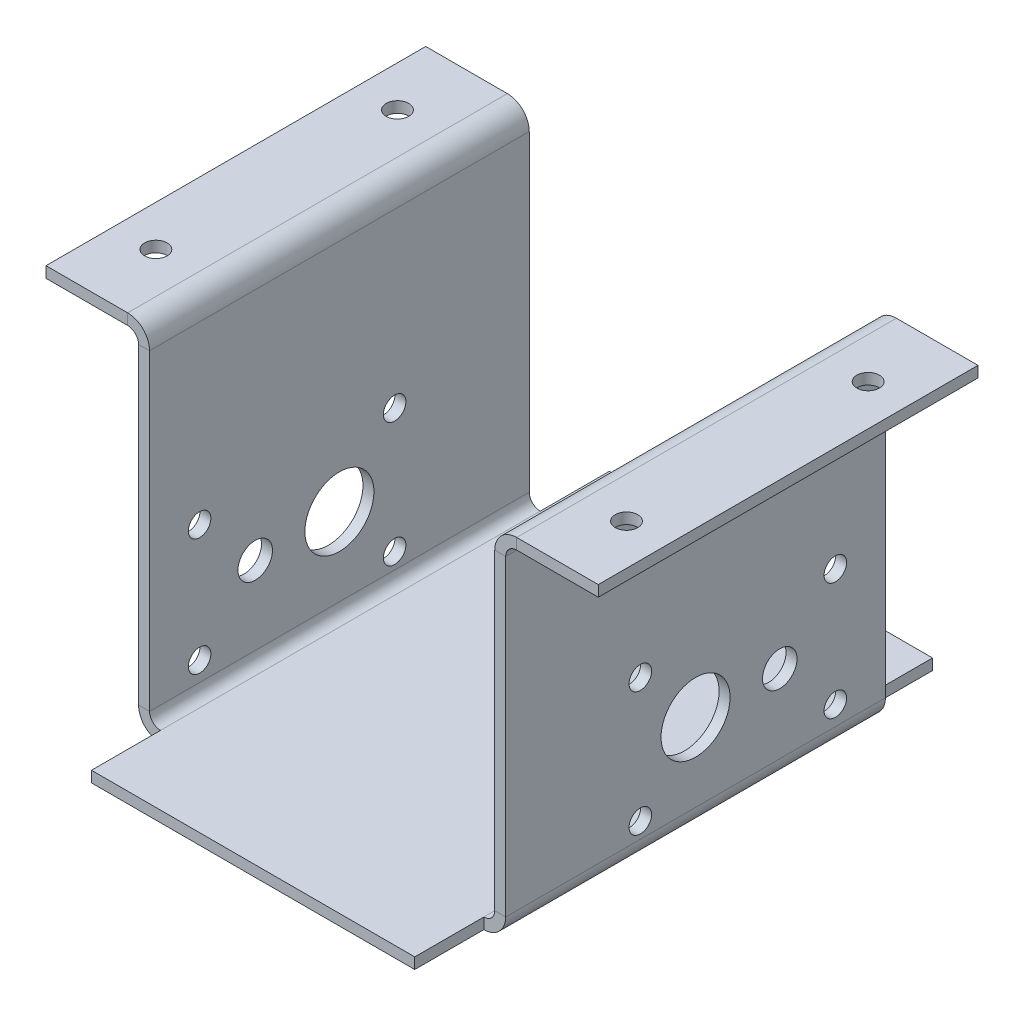
from build123d import *

# Parameters (mm, degrees)
SKETCH1_W                    = 50
SKETCH1_H                    = 75
BASE_FLANGE3_DEPTH           = 1.5875
EDGE_FLANGE1_STRIP_W         = 9.525
EDGE_FLANGE1_STRIP_H         = 1.5875
EDGE_FLANGE1_STRIP_CUT_DEPTH = 75
EDGE_FLANGE1_DEPTH           = 75
EDGE_FLANGE2_STRIP_W         = 9.525
EDGE_FLANGE2_STRIP_H         = 1.5875
EDGE_FLANGE2_STRIP_CUT_DEPTH = 75
EDGE_FLANGE2_DEPTH           = 75
UNFOLD1_START                = -37.5
UNFOLD1_DEPTH                = 75
UNFOLD1_2_DEPTH              = 75
SKETCH36_W                   = 51.908582115
SKETCH36_H                   = 10
EXTRUDE1_DEPTH               = 85.15483092
FOLD1_START                  = -27.5
FOLD1_DEPTH                  = 55
FOLD1_2_DEPTH                = 55
EDGE_FLANGE4_STRIP_W         = 9.525
EDGE_FLANGE4_STRIP_H         = 1.5875
EDGE_FLANGE4_STRIP_CUT_DEPTH = 55
EDGE_FLANGE4_DEPTH           = 55
EDGE_FLANGE5_STRIP_W         = 9.525
EDGE_FLANGE5_STRIP_H         = 1.5875
EDGE_FLANGE5_STRIP_CUT_DEPTH = 55
EDGE_FLANGE5_DEPTH           = 55
F_4_CLEARANCE_HOLE1_D        = 3.2639
SKETCH31_R                   = 5
OUTPUT_SHAFT_CLEARANCE_DEPTH = 93.203119863
SKETCH49_R                   = 2.5
NIPPLE_CLEARANCE_1_DEPTH     = 1.5875
SKETCH50_R                   = 2.5
CUT_EXTRUDE2_DEPTH           = 1.5875
UNFOLD2_START                = -40
UNFOLD2_OUTLINE_W            = 50
UNFOLD2_OUTLINE_H            = 55
UNFOLD2_OUTLINE_R            = 5
UNFOLD2_DEPTH                = 80
UNFOLD2_START_2              = -72.146082115
UNFOLD2_2_OUTLINE_W          = 1.5875
UNFOLD2_2_OUTLINE_H          = 55
UNFOLD2_2_DEPTH              = 28.9344999
UNFOLD2_START_3              = 43.211582215
UNFOLD2_3_OUTLINE_W          = 1.5875
UNFOLD2_3_OUTLINE_H          = 55
UNFOLD2_3_DEPTH              = 28.9344999
UNFOLD2_START_4              = -33.211582015
UNFOLD2_4_OUTLINE_W          = 1.5875
UNFOLD2_4_OUTLINE_H          = 55
UNFOLD2_4_DEPTH              = 66.42316403
UNFOLD2_START_5              = -75.321082115
UNFOLD2_5_OUTLINE_W          = 15
UNFOLD2_5_OUTLINE_H          = 55
UNFOLD2_5_OUTLINE_R          = 1.63195
UNFOLD2_5_DEPTH              = 3.175
UNFOLD2_START_6              = 72.146082115
UNFOLD2_6_OUTLINE_W          = 15
UNFOLD2_6_OUTLINE_H          = 55
UNFOLD2_6_OUTLINE_R          = 1.63195
UNFOLD2_6_DEPTH              = 3.175
UNFOLD2_START_7              = -43.211582215
UNFOLD2_7_OUTLINE_W          = 1.5875
UNFOLD2_7_OUTLINE_H          = 55
UNFOLD2_7_DEPTH              = 86.42316443
UNFOLD2_START_8              = -27.5
UNFOLD2_8_DEPTH              = 55
UNFOLD2_START_9              = -1
UNFOLD2_9_OUTLINE_R          = 5
UNFOLD2_9_OUTLINE_R_2        = 2.5
UNFOLD2_9_DEPTH              = 4
F_4_CLEARANCE_HOLE4_D        = 3.2639
F_4_CLEARANCE_HOLE4_DEPTH    = 3.18
F_4_CLEARANCE_HOLE4_TIP      = 0.980574487
FLAT_PATTERN3_START          = -27.5
FLAT_PATTERN3_DEPTH          = 55
FLAT_PATTERN3_2_DEPTH        = 55


with BuildPart() as part:
    # Base-Flange3: sheet metal written as solids
    # Sketch1 → Base-Flange3 (new body)
    with BuildSketch(Plane(origin=(0, 0, 0), x_dir=(1, 0, 0), z_dir=(0, 1, 0))):
        Rectangle(SKETCH1_W, SKETCH1_H)
    extrude(amount=BASE_FLANGE3_DEPTH)

    # Edge-Flange1: sheet metal written as solids
    # Edge-Flange1 strip (on a plane across the edge) → Edge-Flange1 strip cut (cut)
    with BuildSketch(Plane(origin=(-25, 1.5875, -37.5), x_dir=(1, 0, 0), z_dir=(0, 0, 1))):
        with Locations((-3.175, -0.79375)):
            Rectangle(EDGE_FLANGE1_STRIP_W, EDGE_FLANGE1_STRIP_H)
    extrude(amount=EDGE_FLANGE1_STRIP_CUT_DEPTH, mode=Mode.SUBTRACT)

    # Edge-Flange1 section (on a plane across the edge) → Edge-Flange1 (add)
    with BuildSketch(Plane(origin=(-25, 1.5875, -37.5), x_dir=(1, 0, 0), z_dir=(0, 0, 1))):
        with BuildLine():
            Line((-1.5875, 1.5875), (-1.5875, 50))
            Line((-1.5875, 50), (0, 50))
            Line((0, 50), (0, 1.5875))
            ThreePointArc((0, 1.5875), (0.464967985, 0.464967985), (1.5875, 0))
            Line((1.5875, 0), (1.5875, -1.5875))
            ThreePointArc((1.5875, -1.5875), (-0.65756403, -0.65756403), (-1.5875, 1.5875))
        make_face()
    extrude(amount=EDGE_FLANGE1_DEPTH)

    # Edge-Flange2: sheet metal written as solids
    # Edge-Flange2 strip (on a plane across the edge) → Edge-Flange2 strip cut (cut)
    with BuildSketch(Plane(origin=(25, 1.5875, 37.5), x_dir=(-1, 0, 0), z_dir=(0, 0, -1))):
        with Locations((-3.175, -0.79375)):
            Rectangle(EDGE_FLANGE2_STRIP_W, EDGE_FLANGE2_STRIP_H)
    extrude(amount=EDGE_FLANGE2_STRIP_CUT_DEPTH, mode=Mode.SUBTRACT)

    # Edge-Flange2 section (on a plane across the edge) → Edge-Flange2 (add)
    with BuildSketch(Plane(origin=(25, 1.5875, 37.5), x_dir=(-1, 0, 0), z_dir=(0, 0, -1))):
        with BuildLine():
            Line((-1.5875, 1.5875), (-1.5875, 50))
            Line((-1.5875, 50), (0, 50))
            Line((0, 50), (0, 1.5875))
            ThreePointArc((0, 1.5875), (0.464967985, 0.464967985), (1.5875, 0))
            Line((1.5875, 0), (1.5875, -1.5875))
            ThreePointArc((1.5875, -1.5875), (-0.65756403, -0.65756403), (-1.5875, 1.5875))
        make_face()
    extrude(amount=EDGE_FLANGE2_DEPTH)

    # Unfold1: read off the stored shape, not the designer's step
    # Unfold1 outline → Unfold1 (cut)
    with BuildSketch(Plane.XY.offset(UNFOLD1_START)):
        with BuildLine():
            Line((-26.162130657, 1.5875), (-23.4125, 1.5875))
            ThreePointArc((-23.4125, 1.5875), (-24.535032015, 2.052467985), (-25, 3.175))
            Line((-25, 3.175), (-25, 51.5875))
            Line((-25, 51.5875), (-26.5875, 51.5875))
            Line((-26.5875, 51.5875), (-26.5875, 3.175))
            ThreePointArc((-26.5875, 3.175), (-26.479314498, 2.353249532), (-26.162130657, 1.5875))
        make_face()
        with BuildLine():
            Line((23.4125, 1.5875), (26.162130657, 1.5875))
            ThreePointArc((26.162130657, 1.5875), (26.479314498, 2.353249532), (26.5875, 3.175))
            Line((26.5875, 3.175), (26.5875, 51.5875))
            Line((26.5875, 51.5875), (25, 51.5875))
            Line((25, 51.5875), (25, 3.175))
            ThreePointArc((25, 3.175), (24.535032015, 2.052467985), (23.4125, 1.5875))
        make_face()
    extrude(amount=UNFOLD1_DEPTH, mode=Mode.SUBTRACT)

    # Unfold1 2 outline → Unfold1 2 (add)
    with BuildSketch(Plane.XY.offset(UNFOLD1_START)):
        with BuildLine():
            ThreePointArc((-23.4125, 0), (-25, 0.425369343), (-26.162130657, 1.5875))
            Line((-26.162130657, 1.5875), (-75.321082115, 1.5875))
            Line((-75.321082115, 1.5875), (-75.321082115, 0))
            Line((-75.321082115, 0), (-23.4125, 0))
        make_face()
        with BuildLine():
            Line((75.321082115, 1.5875), (26.162130657, 1.5875))
            ThreePointArc((26.162130657, 1.5875), (25, 0.425369343), (23.4125, 0))
            Line((23.4125, 0), (75.321082115, 0))
            Line((75.321082115, 0), (75.321082115, 1.5875))
        make_face()
    extrude(amount=UNFOLD1_2_DEPTH)

    # Sketch36 → Extrude1 (cut, through all)
    with BuildSketch(Plane(origin=(0, 1.5875, 0), x_dir=(1, 0, 0), z_dir=(0, 1, 0))):
        with Locations((-49.366791058, 32.5)):
            Rectangle(SKETCH36_W, SKETCH36_H)
        with Locations((49.366791058, 32.5)):
            Rectangle(SKETCH36_W, SKETCH36_H)
        with Locations((-49.366791058, -32.5)):
            Rectangle(SKETCH36_W, SKETCH36_H)
        with Locations((49.366791058, -32.5)):
            Rectangle(SKETCH36_W, SKETCH36_H)
    extrude(amount=-EXTRUDE1_DEPTH, mode=Mode.SUBTRACT)

    # Fold1: read off the stored shape, not the designer's step
    # Fold1 outline → Fold1 (cut)
    with BuildSketch(Plane.XY.offset(FOLD1_START)):
        with BuildLine():
            ThreePointArc((-23.4125, 0), (-25, 0.425369343), (-26.162130657, 1.5875))
            Line((-26.162130657, 1.5875), (-75.321082115, 1.5875))
            Line((-75.321082115, 1.5875), (-75.321082115, 0))
            Line((-75.321082115, 0), (-23.4125, 0))
        make_face()
        with BuildLine():
            Line((75.321082115, 1.5875), (26.162130657, 1.5875))
            ThreePointArc((26.162130657, 1.5875), (25, 0.425369343), (23.4125, 0))
            Line((23.4125, 0), (75.321082115, 0))
            Line((75.321082115, 0), (75.321082115, 1.5875))
        make_face()
    extrude(amount=FOLD1_DEPTH, mode=Mode.SUBTRACT)

    # Fold1 2 outline → Fold1 2 (add)
    with BuildSketch(Plane.XY.offset(FOLD1_START)):
        with BuildLine():
            ThreePointArc((-23.4125, 1.5875), (-24.535032015, 2.052467985), (-25, 3.175))
            Line((-25, 3.175), (-25, 51.5875))
            Line((-25, 51.5875), (-26.5875, 51.5875))
            Line((-26.5875, 51.5875), (-26.5875, 3.175))
            ThreePointArc((-26.5875, 3.175), (-26.479314498, 2.353249532), (-26.162130657, 1.5875))
            Line((-26.162130657, 1.5875), (-23.4125, 1.5875))
        make_face()
        with BuildLine():
            Line((26.5875, 51.5875), (25, 51.5875))
            Line((25, 51.5875), (25, 3.175))
            ThreePointArc((25, 3.175), (24.535032015, 2.052467985), (23.4125, 1.5875))
            Line((23.4125, 1.5875), (26.162130657, 1.5875))
            ThreePointArc((26.162130657, 1.5875), (26.479314498, 2.353249532), (26.5875, 3.175))
            Line((26.5875, 3.175), (26.5875, 51.5875))
        make_face()
    extrude(amount=FOLD1_2_DEPTH)

    # Edge-Flange4: sheet metal written as solids
    # Edge-Flange4 strip (on a plane across the edge) → Edge-Flange4 strip cut (cut)
    with BuildSketch(Plane(origin=(-26.5875, 51.5875, 27.5), x_dir=(0, -1, 0), z_dir=(0, 0, -1))):
        with Locations((-1.5875, -0.79375)):
            Rectangle(EDGE_FLANGE4_STRIP_W, EDGE_FLANGE4_STRIP_H)
    extrude(amount=EDGE_FLANGE4_STRIP_CUT_DEPTH, mode=Mode.SUBTRACT)

    # Edge-Flange4 section (on a plane across the edge) → Edge-Flange4 (add)
    with BuildSketch(Plane(origin=(-26.5875, 51.5875, 27.5), x_dir=(0, -1, 0), z_dir=(0, 0, -1))):
        with BuildLine():
            Line((0, 1.5875), (0, 13.4125))
            Line((0, 13.4125), (1.5875, 13.4125))
            Line((1.5875, 13.4125), (1.5875, 1.5875))
            ThreePointArc((1.5875, 1.5875), (2.052467985, 0.464967985), (3.175, 0))
            Line((3.175, 0), (3.175, -1.5875))
            ThreePointArc((3.175, -1.5875), (0.92993597, -0.65756403), (0, 1.5875))
        make_face()
    extrude(amount=EDGE_FLANGE4_DEPTH)

    # Edge-Flange5: sheet metal written as solids
    # Edge-Flange5 strip (on a plane across the edge) → Edge-Flange5 strip cut (cut)
    with BuildSketch(Plane(origin=(26.5875, 51.5875, -27.5), x_dir=(0, -1, 0), z_dir=(0, 0, 1))):
        with Locations((-1.5875, -0.79375)):
            Rectangle(EDGE_FLANGE5_STRIP_W, EDGE_FLANGE5_STRIP_H)
    extrude(amount=EDGE_FLANGE5_STRIP_CUT_DEPTH, mode=Mode.SUBTRACT)

    # Edge-Flange5 section (on a plane across the edge) → Edge-Flange5 (add)
    with BuildSketch(Plane(origin=(26.5875, 51.5875, -27.5), x_dir=(0, -1, 0), z_dir=(0, 0, 1))):
        with BuildLine():
            Line((0, 1.5875), (0, 13.4125))
            Line((0, 13.4125), (1.5875, 13.4125))
            Line((1.5875, 13.4125), (1.5875, 1.5875))
            ThreePointArc((1.5875, 1.5875), (2.052467985, 0.464967985), (3.175, 0))
            Line((3.175, 0), (3.175, -1.5875))
            ThreePointArc((3.175, -1.5875), (0.92993597, -0.65756403), (0, 1.5875))
        make_face()
    extrude(amount=EDGE_FLANGE5_DEPTH)

    # #4 Clearance Hole1 (through all)
    with Locations(Plane(origin=(0, 51.5875, 0), x_dir=(-1, 0, 0), z_dir=(0, 1, 0))):
        with Locations((34.0875, -17.5), (34.0875, 17.5), (-34.0875, -17.5), (-34.0875, 17.5)):
            Hole(F_4_CLEARANCE_HOLE1_D / 2)

    # Sketch31 → Output shaft clearance (cut, through all)
    with BuildSketch(Plane(origin=(26.5875, 0, 0), x_dir=(0, 0, -1), z_dir=(1, 0, 0))):
        with Locations(Location((0, 14.478, 0), (0, 0, 90))):
            Circle(SKETCH31_R)
    extrude(amount=-OUTPUT_SHAFT_CLEARANCE_DEPTH, mode=Mode.SUBTRACT)

    # Sketch49 → Nipple Clearance 1 (cut)
    with BuildSketch(Plane(origin=(26.5875, 0, 0), x_dir=(0, 0, -1), z_dir=(1, 0, 0))):
        with Locations(Location((12.19708, 14.478, 0), (0, 0, 90))):
            Circle(SKETCH49_R)
    extrude(amount=-NIPPLE_CLEARANCE_1_DEPTH, mode=Mode.SUBTRACT)

    # Sketch50 → Cut-Extrude2 (cut)
    with BuildSketch(Plane.ZY.offset(26.5875)):
        with Locations(Location((12.19708, 14.478, 0), (0, 0, 270))):
            Circle(SKETCH50_R)
    extrude(amount=-CUT_EXTRUDE2_DEPTH, mode=Mode.SUBTRACT)

    # Unfold2: read off the stored shape, not the designer's step
    # Unfold2 outline → Unfold2 (cut)
    with BuildSketch(Plane.YZ.offset(UNFOLD2_START)):
        with Locations((26.5875, 0)):
            Rectangle(UNFOLD2_OUTLINE_W, UNFOLD2_OUTLINE_H)
        with Locations((14.478, 0)):
            Circle(UNFOLD2_OUTLINE_R, mode=Mode.SUBTRACT)
    extrude(amount=UNFOLD2_DEPTH, mode=Mode.SUBTRACT)

    # Unfold2 4 outline → Unfold2 4 (add)
    with BuildSketch(Plane.YZ.offset(UNFOLD2_START_4)):
        with Locations((0.79375, 0)):
            Rectangle(UNFOLD2_4_OUTLINE_W, UNFOLD2_4_OUTLINE_H)
    extrude(amount=UNFOLD2_4_DEPTH)



with BuildPart() as body_2:
    # Unfold2 2 outline → Unfold2 2 (new body)
    with BuildSketch(Plane.YZ.offset(UNFOLD2_START_2)):
        with Locations((0.79375, 0)):
            Rectangle(UNFOLD2_2_OUTLINE_W, UNFOLD2_2_OUTLINE_H)
    extrude(amount=UNFOLD2_2_DEPTH)

    # Unfold2 5 outline → Unfold2 5 (add)
    with BuildSketch(Plane.YZ.offset(UNFOLD2_START_5)):
        with Locations((-5.9125, 0)):
            Rectangle(UNFOLD2_5_OUTLINE_W, UNFOLD2_5_OUTLINE_H)
        with Locations((-7.5, 17.5)):
            Circle(UNFOLD2_5_OUTLINE_R, mode=Mode.SUBTRACT)
        with Locations((-7.5, -17.5)):
            Circle(UNFOLD2_5_OUTLINE_R, mode=Mode.SUBTRACT)
    extrude(amount=UNFOLD2_5_DEPTH)


with BuildPart() as body_3:
    # Unfold2 3 outline → Unfold2 3 (new body)
    with BuildSketch(Plane.YZ.offset(UNFOLD2_START_3)):
        with Locations((0.79375, 0)):
            Rectangle(UNFOLD2_3_OUTLINE_W, UNFOLD2_3_OUTLINE_H)
    extrude(amount=UNFOLD2_3_DEPTH)

    # Unfold2 6 outline → Unfold2 6 (add)
    with BuildSketch(Plane.YZ.offset(UNFOLD2_START_6)):
        with Locations((-5.9125, 0)):
            Rectangle(UNFOLD2_6_OUTLINE_W, UNFOLD2_6_OUTLINE_H)
        with Locations((-7.5, 17.5)):
            Circle(UNFOLD2_6_OUTLINE_R, mode=Mode.SUBTRACT)
        with Locations((-7.5, -17.5)):
            Circle(UNFOLD2_6_OUTLINE_R, mode=Mode.SUBTRACT)
    extrude(amount=UNFOLD2_6_DEPTH)


with BuildPart() as part_1:
    add(part.part)

    add(body_2.part)  # Unfold2 7 merges body 2

    add(body_3.part)  # Unfold2 7 merges body 3
    # Unfold2 7 outline → Unfold2 7 (add)
    with BuildSketch(Plane.YZ.offset(UNFOLD2_START_7)):
        with Locations((0.79375, 0)):
            Rectangle(UNFOLD2_7_OUTLINE_W, UNFOLD2_7_OUTLINE_H)
    extrude(amount=UNFOLD2_7_DEPTH)

    # Unfold2 8 outline → Unfold2 8 (cut)
    with BuildSketch(Plane.XY.offset(UNFOLD2_START_8)):
        with BuildLine():
            Line((-73.733582115, -1.5875), (-73.733582115, -13.4125))
            Line((-73.733582115, -13.4125), (-72.146082115, -13.4125))
            Line((-72.146082115, -13.4125), (-72.146082115, 0))
            ThreePointArc((-72.146082115, 0), (-73.26861413, -0.464967985), (-73.733582115, -1.5875))
        make_face()
        with BuildLine():
            Line((-75.321082115, 1.5875), (-75.321082115, -1.5875))
            ThreePointArc((-75.321082115, -1.5875), (-74.391146145, 0.65756403), (-72.146082115, 1.5875))
            Line((-72.146082115, 1.5875), (-75.321082115, 1.5875))
        make_face()
        with BuildLine():
            ThreePointArc((73.733582115, -1.5875), (73.26861413, -0.464967985), (72.146082115, 0))
            Line((72.146082115, 0), (72.146082115, -13.4125))
            Line((72.146082115, -13.4125), (73.733582115, -13.4125))
            Line((73.733582115, -13.4125), (73.733582115, -1.5875))
        make_face()
        with BuildLine():
            Line((75.321082115, 1.5875), (72.146082115, 1.5875))
            ThreePointArc((72.146082115, 1.5875), (74.391146145, 0.65756403), (75.321082115, -1.5875))
            Line((75.321082115, -1.5875), (75.321082115, 1.5875))
        make_face()
    extrude(amount=UNFOLD2_8_DEPTH, mode=Mode.SUBTRACT)

    # Unfold2 9 outline → Unfold2 9 (cut)
    with BuildSketch(Plane(origin=(0, 0, 0), x_dir=(1, 0, 0), z_dir=(0, 1, 0)).offset(UNFOLD2_START_9)):
        with Locations((-38.211582115, 0)):
            Circle(UNFOLD2_9_OUTLINE_R)
        with Locations((-38.211582115, -12.19708)):
            Circle(UNFOLD2_9_OUTLINE_R_2)
        with Locations((38.211582115, 0)):
            Circle(UNFOLD2_9_OUTLINE_R)
        with Locations((38.211582115, 12.19708)):
            Circle(UNFOLD2_9_OUTLINE_R_2)
    extrude(amount=UNFOLD2_9_DEPTH, mode=Mode.SUBTRACT)

    # #4 Clearance Hole4
    with Locations(Plane(origin=(0, 1.5875, 0), x_dir=(-1, 0, 0), z_dir=(0, 1, 0))):
        with Locations((29.212362115, -7.99846), (29.711472115, 20.25142), (46.711692115, 20.25142), (47.210802115, -7.99846), (-29.711472115, -20.25142), (-46.711692115, -20.25142), (-47.210802115, 7.99846), (-29.212362115, 7.99846)):
            Hole(F_4_CLEARANCE_HOLE4_D / 2, depth=F_4_CLEARANCE_HOLE4_DEPTH)
            with Locations((0, 0, -(F_4_CLEARANCE_HOLE4_DEPTH + F_4_CLEARANCE_HOLE4_TIP / 2))):  # 118° drill point
                Cone(0, F_4_CLEARANCE_HOLE4_D / 2, F_4_CLEARANCE_HOLE4_TIP, mode=Mode.SUBTRACT)

    # Flat-Pattern3: read off the stored shape, not the designer's step
    # Flat-Pattern3 outline → Flat-Pattern3 (cut)
    with BuildSketch(Plane.XY.offset(FLAT_PATTERN3_START)):
        with BuildLine():
            ThreePointArc((-23.4125, 0), (-25, 0.425369343), (-26.162130657, 1.5875))
            Line((-26.162130657, 1.5875), (-72.146082115, 1.5875))
            ThreePointArc((-72.146082115, 1.5875), (-74.391146145, 0.65756403), (-75.321082115, -1.5875))
            Line((-75.321082115, -1.5875), (-75.321082115, -13.4125))
            Line((-75.321082115, -13.4125), (-73.733582115, -13.4125))
            Line((-73.733582115, -13.4125), (-73.733582115, -1.5875))
            ThreePointArc((-73.733582115, -1.5875), (-73.26861413, -0.464967985), (-72.146082115, 0))
            Line((-72.146082115, 0), (-23.4125, 0))
        make_face()
        with BuildLine():
            Line((72.146082115, 1.5875), (26.162130657, 1.5875))
            ThreePointArc((26.162130657, 1.5875), (25, 0.425369343), (23.4125, 0))
            Line((23.4125, 0), (72.146082115, 0))
            ThreePointArc((72.146082115, 0), (73.26861413, -0.464967985), (73.733582115, -1.5875))
            Line((73.733582115, -1.5875), (73.733582115, -13.4125))
            Line((73.733582115, -13.4125), (75.321082115, -13.4125))
            Line((75.321082115, -13.4125), (75.321082115, -1.5875))
            ThreePointArc((75.321082115, -1.5875), (74.391146145, 0.65756403), (72.146082115, 1.5875))
        make_face()
    extrude(amount=FLAT_PATTERN3_DEPTH, mode=Mode.SUBTRACT)

    # Flat-Pattern3 2 outline → Flat-Pattern3 2 (add)
    with BuildSketch(Plane.XY.offset(FLAT_PATTERN3_START)):
        with BuildLine():
            ThreePointArc((-23.4125, 1.5875), (-24.535032015, 2.052467985), (-25, 3.175))
            Line((-25, 3.175), (-25, 48.4125))
            ThreePointArc((-25, 48.4125), (-25.92993597, 50.65756403), (-28.175, 51.5875))
            Line((-28.175, 51.5875), (-40, 51.5875))
            Line((-40, 51.5875), (-40, 50))
            Line((-40, 50), (-28.175, 50))
            ThreePointArc((-28.175, 50), (-27.052467985, 49.535032015), (-26.5875, 48.4125))
            Line((-26.5875, 48.4125), (-26.5875, 3.175))
            ThreePointArc((-26.5875, 3.175), (-26.479314498, 2.353249532), (-26.162130657, 1.5875))
            Line((-26.162130657, 1.5875), (-23.4125, 1.5875))
        make_face()
        with BuildLine():
            ThreePointArc((26.5875, 48.4125), (27.052467985, 49.535032015), (28.175, 50))
            Line((28.175, 50), (40, 50))
            Line((40, 50), (40, 51.5875))
            Line((40, 51.5875), (28.175, 51.5875))
            ThreePointArc((28.175, 51.5875), (25.92993597, 50.65756403), (25, 48.4125))
            Line((25, 48.4125), (25, 3.175))
            ThreePointArc((25, 3.175), (24.535032015, 2.052467985), (23.4125, 1.5875))
            Line((23.4125, 1.5875), (26.162130657, 1.5875))
            ThreePointArc((26.162130657, 1.5875), (26.479314498, 2.353249532), (26.5875, 3.175))
            Line((26.5875, 3.175), (26.5875, 48.4125))
        make_face()
    extrude(amount=FLAT_PATTERN3_2_DEPTH)

    # Flat-Pattern3 3: loft between two sections, ruled curve by curve
    flat_pattern3_3_from = [
        Edge.make_three_point_arc((-34.0875, 50, 19.13195), (-32.45555, 50, 17.5), (-34.0875, 50, 15.86805)),
        Edge.make_three_point_arc((-34.0875, 50, 15.86805), (-35.71945, 50, 17.5), (-34.0875, 50, 19.13195)),
    ]
    flat_pattern3_3_to = [
        Edge.make_three_point_arc((-34.0875, 51.5875, 19.13195), (-32.45555, 51.5875, 17.5), (-34.0875, 51.5875, 15.86805)),
        Edge.make_three_point_arc((-34.0875, 51.5875, 15.86805), (-35.71945, 51.5875, 17.5), (-34.0875, 51.5875, 19.13195)),
    ]
    flat_pattern3_3 = Solid(Shell([*[Face.make_surface_from_curves(flat_pattern3_3_from[k], flat_pattern3_3_to[k]) for k in range(2)], Face(Wire(flat_pattern3_3_from)), Face(Wire(flat_pattern3_3_to))]))
    add(flat_pattern3_3, mode=Mode.SUBTRACT)

    # Flat-Pattern3 4: loft between two sections, ruled curve by curve
    flat_pattern3_4_from = [
        Edge.make_three_point_arc((-34.0875, 50, -15.86805), (-32.45555, 50, -17.5), (-34.0875, 50, -19.13195)),
        Edge.make_three_point_arc((-34.0875, 50, -19.13195), (-35.71945, 50, -17.5), (-34.0875, 50, -15.86805)),
    ]
    flat_pattern3_4_to = [
        Edge.make_three_point_arc((-34.0875, 51.5875, -15.86805), (-32.45555, 51.5875, -17.5), (-34.0875, 51.5875, -19.13195)),
        Edge.make_three_point_arc((-34.0875, 51.5875, -19.13195), (-35.71945, 51.5875, -17.5), (-34.0875, 51.5875, -15.86805)),
    ]
    flat_pattern3_4 = Solid(Shell([*[Face.make_surface_from_curves(flat_pattern3_4_from[k], flat_pattern3_4_to[k]) for k in range(2)], Face(Wire(flat_pattern3_4_from)), Face(Wire(flat_pattern3_4_to))]))
    add(flat_pattern3_4, mode=Mode.SUBTRACT)

    # Flat-Pattern3 5: loft between two sections, ruled curve by curve
    flat_pattern3_5_from = [
        Edge.make_three_point_arc((-26.5875, 19.478, 0), (-26.5875, 14.478, 5), (-26.5875, 9.478, 0)),
        Edge.make_three_point_arc((-26.5875, 9.478, 0), (-26.5875, 14.478, -5), (-26.5875, 19.478, 0)),
    ]
    flat_pattern3_5_to = [
        Edge.make_three_point_arc((-25, 19.478, 0), (-25, 14.478, 5), (-25, 9.478, 0)),
        Edge.make_three_point_arc((-25, 9.478, 0), (-25, 14.478, -5), (-25, 19.478, 0)),
    ]
    flat_pattern3_5 = Solid(Shell([*[Face.make_surface_from_curves(flat_pattern3_5_from[k], flat_pattern3_5_to[k]) for k in range(2)], Face(Wire(flat_pattern3_5_from)), Face(Wire(flat_pattern3_5_to))]))
    add(flat_pattern3_5, mode=Mode.SUBTRACT)

    # Flat-Pattern3 6: loft between two sections, ruled curve by curve
    flat_pattern3_6_from = [
        Edge.make_three_point_arc((25, 19.478, 0), (25, 14.478, 5), (25, 9.478, 0)),
        Edge.make_three_point_arc((25, 9.478, 0), (25, 14.478, -5), (25, 19.478, 0)),
    ]
    flat_pattern3_6_to = [
        Edge.make_three_point_arc((26.5875, 19.478, 0), (26.5875, 14.478, 5), (26.5875, 9.478, 0)),
        Edge.make_three_point_arc((26.5875, 9.478, 0), (26.5875, 14.478, -5), (26.5875, 19.478, 0)),
    ]
    flat_pattern3_6 = Solid(Shell([*[Face.make_surface_from_curves(flat_pattern3_6_from[k], flat_pattern3_6_to[k]) for k in range(2)], Face(Wire(flat_pattern3_6_from)), Face(Wire(flat_pattern3_6_to))]))
    add(flat_pattern3_6, mode=Mode.SUBTRACT)

    # Flat-Pattern3 7: loft between two sections, ruled curve by curve
    flat_pattern3_7_from = [
        Edge.make_three_point_arc((-25, 11.978, 12.19708), (-25, 14.478, 14.69708), (-25, 16.978, 12.19708)),
        Edge.make_three_point_arc((-25, 16.978, 12.19708), (-25, 14.478, 9.69708), (-25, 11.978, 12.19708)),
    ]
    flat_pattern3_7_to = [
        Edge.make_three_point_arc((-26.5875, 11.978, 12.19708), (-26.5875, 14.478, 14.69708), (-26.5875, 16.978, 12.19708)),
        Edge.make_three_point_arc((-26.5875, 16.978, 12.19708), (-26.5875, 14.478, 9.69708), (-26.5875, 11.978, 12.19708)),
    ]
    flat_pattern3_7 = Solid(Shell([*[Face.make_surface_from_curves(flat_pattern3_7_from[k], flat_pattern3_7_to[k]) for k in range(2)], Face(Wire(flat_pattern3_7_from)), Face(Wire(flat_pattern3_7_to))]))
    add(flat_pattern3_7, mode=Mode.SUBTRACT)

    # Flat-Pattern3 8: loft between two sections, ruled curve by curve
    flat_pattern3_8_from = [
        Edge.make_three_point_arc((-26.5875, 23.47722, -6.36651), (-26.5875, 21.84527, -7.99846), (-26.5875, 23.47722, -9.63041)),
        Edge.make_three_point_arc((-26.5875, 23.47722, -9.63041), (-26.5875, 25.10917, -7.99846), (-26.5875, 23.47722, -6.36651)),
    ]
    flat_pattern3_8_to = [
        Edge.make_three_point_arc((-25, 23.47722, -6.36651), (-25, 21.84527, -7.99846), (-25, 23.47722, -9.63041)),
        Edge.make_three_point_arc((-25, 23.47722, -9.63041), (-25, 25.10917, -7.99846), (-25, 23.47722, -6.36651)),
    ]
    flat_pattern3_8 = Solid(Shell([*[Face.make_surface_from_curves(flat_pattern3_8_from[k], flat_pattern3_8_to[k]) for k in range(2)], Face(Wire(flat_pattern3_8_from)), Face(Wire(flat_pattern3_8_to))]))
    add(flat_pattern3_8, mode=Mode.SUBTRACT)

    # Flat-Pattern3 9: loft between two sections, ruled curve by curve
    flat_pattern3_9_from = [
        Edge.make_three_point_arc((-26.5875, 22.97811, 21.88337), (-26.5875, 21.34616, 20.25142), (-26.5875, 22.97811, 18.61947)),
        Edge.make_three_point_arc((-26.5875, 22.97811, 18.61947), (-26.5875, 24.61006, 20.25142), (-26.5875, 22.97811, 21.88337)),
    ]
    flat_pattern3_9_to = [
        Edge.make_three_point_arc((-25, 22.97811, 21.88337), (-25, 21.34616, 20.25142), (-25, 22.97811, 18.61947)),
        Edge.make_three_point_arc((-25, 22.97811, 18.61947), (-25, 24.61006, 20.25142), (-25, 22.97811, 21.88337)),
    ]
    flat_pattern3_9 = Solid(Shell([*[Face.make_surface_from_curves(flat_pattern3_9_from[k], flat_pattern3_9_to[k]) for k in range(2)], Face(Wire(flat_pattern3_9_from)), Face(Wire(flat_pattern3_9_to))]))
    add(flat_pattern3_9, mode=Mode.SUBTRACT)

    # Flat-Pattern3 10: loft between two sections, ruled curve by curve
    flat_pattern3_10_from = [
        Edge.make_three_point_arc((-26.5875, 5.97789, 21.88337), (-26.5875, 4.34594, 20.25142), (-26.5875, 5.97789, 18.61947)),
        Edge.make_three_point_arc((-26.5875, 5.97789, 18.61947), (-26.5875, 7.60984, 20.25142), (-26.5875, 5.97789, 21.88337)),
    ]
    flat_pattern3_10_to = [
        Edge.make_three_point_arc((-25, 5.97789, 21.88337), (-25, 4.34594, 20.25142), (-25, 5.97789, 18.61947)),
        Edge.make_three_point_arc((-25, 5.97789, 18.61947), (-25, 7.60984, 20.25142), (-25, 5.97789, 21.88337)),
    ]
    flat_pattern3_10 = Solid(Shell([*[Face.make_surface_from_curves(flat_pattern3_10_from[k], flat_pattern3_10_to[k]) for k in range(2)], Face(Wire(flat_pattern3_10_from)), Face(Wire(flat_pattern3_10_to))]))
    add(flat_pattern3_10, mode=Mode.SUBTRACT)

    # Flat-Pattern3 11: loft between two sections, ruled curve by curve
    flat_pattern3_11_from = [
        Edge.make_three_point_arc((-26.5875, 5.47878, -6.36651), (-26.5875, 3.84683, -7.99846), (-26.5875, 5.47878, -9.63041)),
        Edge.make_three_point_arc((-26.5875, 5.47878, -9.63041), (-26.5875, 7.11073, -7.99846), (-26.5875, 5.47878, -6.36651)),
    ]
    flat_pattern3_11_to = [
        Edge.make_three_point_arc((-25, 5.47878, -6.36651), (-25, 3.84683, -7.99846), (-25, 5.47878, -9.63041)),
        Edge.make_three_point_arc((-25, 5.47878, -9.63041), (-25, 7.11073, -7.99846), (-25, 5.47878, -6.36651)),
    ]
    flat_pattern3_11 = Solid(Shell([*[Face.make_surface_from_curves(flat_pattern3_11_from[k], flat_pattern3_11_to[k]) for k in range(2)], Face(Wire(flat_pattern3_11_from)), Face(Wire(flat_pattern3_11_to))]))
    add(flat_pattern3_11, mode=Mode.SUBTRACT)

    # Flat-Pattern3 12: loft between two sections, ruled curve by curve
    flat_pattern3_12_from = [
        Edge.make_three_point_arc((34.0875, 50, 19.13195), (35.71945, 50, 17.5), (34.0875, 50, 15.86805)),
        Edge.make_three_point_arc((34.0875, 50, 15.86805), (32.45555, 50, 17.5), (34.0875, 50, 19.13195)),
    ]
    flat_pattern3_12_to = [
        Edge.make_three_point_arc((34.0875, 51.5875, 19.13195), (35.71945, 51.5875, 17.5), (34.0875, 51.5875, 15.86805)),
        Edge.make_three_point_arc((34.0875, 51.5875, 15.86805), (32.45555, 51.5875, 17.5), (34.0875, 51.5875, 19.13195)),
    ]
    flat_pattern3_12 = Solid(Shell([*[Face.make_surface_from_curves(flat_pattern3_12_from[k], flat_pattern3_12_to[k]) for k in range(2)], Face(Wire(flat_pattern3_12_from)), Face(Wire(flat_pattern3_12_to))]))
    add(flat_pattern3_12, mode=Mode.SUBTRACT)

    # Flat-Pattern3 13: loft between two sections, ruled curve by curve
    flat_pattern3_13_from = [
        Edge.make_three_point_arc((34.0875, 50, -15.86805), (35.71945, 50, -17.5), (34.0875, 50, -19.13195)),
        Edge.make_three_point_arc((34.0875, 50, -19.13195), (32.45555, 50, -17.5), (34.0875, 50, -15.86805)),
    ]
    flat_pattern3_13_to = [
        Edge.make_three_point_arc((34.0875, 51.5875, -15.86805), (35.71945, 51.5875, -17.5), (34.0875, 51.5875, -19.13195)),
        Edge.make_three_point_arc((34.0875, 51.5875, -19.13195), (32.45555, 51.5875, -17.5), (34.0875, 51.5875, -15.86805)),
    ]
    flat_pattern3_13 = Solid(Shell([*[Face.make_surface_from_curves(flat_pattern3_13_from[k], flat_pattern3_13_to[k]) for k in range(2)], Face(Wire(flat_pattern3_13_from)), Face(Wire(flat_pattern3_13_to))]))
    add(flat_pattern3_13, mode=Mode.SUBTRACT)

    # Flat-Pattern3 14: loft between two sections, ruled curve by curve
    flat_pattern3_14_from = [
        Edge.make_three_point_arc((25, 16.978, -12.19708), (25, 14.478, -9.69708), (25, 11.978, -12.19708)),
        Edge.make_three_point_arc((25, 11.978, -12.19708), (25, 14.478, -14.69708), (25, 16.978, -12.19708)),
    ]
    flat_pattern3_14_to = [
        Edge.make_three_point_arc((26.5875, 16.978, -12.19708), (26.5875, 14.478, -9.69708), (26.5875, 11.978, -12.19708)),
        Edge.make_three_point_arc((26.5875, 11.978, -12.19708), (26.5875, 14.478, -14.69708), (26.5875, 16.978, -12.19708)),
    ]
    flat_pattern3_14 = Solid(Shell([*[Face.make_surface_from_curves(flat_pattern3_14_from[k], flat_pattern3_14_to[k]) for k in range(2)], Face(Wire(flat_pattern3_14_from)), Face(Wire(flat_pattern3_14_to))]))
    add(flat_pattern3_14, mode=Mode.SUBTRACT)

    # Flat-Pattern3 15: loft between two sections, ruled curve by curve
    flat_pattern3_15_from = [
        Edge.make_three_point_arc((26.5875, 5.47878, 9.63041), (26.5875, 7.11073, 7.99846), (26.5875, 5.47878, 6.36651)),
        Edge.make_three_point_arc((26.5875, 5.47878, 6.36651), (26.5875, 3.84683, 7.99846), (26.5875, 5.47878, 9.63041)),
    ]
    flat_pattern3_15_to = [
        Edge.make_three_point_arc((25, 5.47878, 9.63041), (25, 7.11073, 7.99846), (25, 5.47878, 6.36651)),
        Edge.make_three_point_arc((25, 5.47878, 6.36651), (25, 3.84683, 7.99846), (25, 5.47878, 9.63041)),
    ]
    flat_pattern3_15 = Solid(Shell([*[Face.make_surface_from_curves(flat_pattern3_15_from[k], flat_pattern3_15_to[k]) for k in range(2)], Face(Wire(flat_pattern3_15_from)), Face(Wire(flat_pattern3_15_to))]))
    add(flat_pattern3_15, mode=Mode.SUBTRACT)

    # Flat-Pattern3 16: loft between two sections, ruled curve by curve
    flat_pattern3_16_from = [
        Edge.make_three_point_arc((26.5875, 23.47722, 9.63041), (26.5875, 25.10917, 7.99846), (26.5875, 23.47722, 6.36651)),
        Edge.make_three_point_arc((26.5875, 23.47722, 6.36651), (26.5875, 21.84527, 7.99846), (26.5875, 23.47722, 9.63041)),
    ]
    flat_pattern3_16_to = [
        Edge.make_three_point_arc((25, 23.47722, 9.63041), (25, 25.10917, 7.99846), (25, 23.47722, 6.36651)),
        Edge.make_three_point_arc((25, 23.47722, 6.36651), (25, 21.84527, 7.99846), (25, 23.47722, 9.63041)),
    ]
    flat_pattern3_16 = Solid(Shell([*[Face.make_surface_from_curves(flat_pattern3_16_from[k], flat_pattern3_16_to[k]) for k in range(2)], Face(Wire(flat_pattern3_16_from)), Face(Wire(flat_pattern3_16_to))]))
    add(flat_pattern3_16, mode=Mode.SUBTRACT)

    # Flat-Pattern3 17: loft between two sections, ruled curve by curve
    flat_pattern3_17_from = [
        Edge.make_three_point_arc((26.5875, 22.97811, -18.61947), (26.5875, 24.61006, -20.25142), (26.5875, 22.97811, -21.88337)),
        Edge.make_three_point_arc((26.5875, 22.97811, -21.88337), (26.5875, 21.34616, -20.25142), (26.5875, 22.97811, -18.61947)),
    ]
    flat_pattern3_17_to = [
        Edge.make_three_point_arc((25, 22.97811, -18.61947), (25, 24.61006, -20.25142), (25, 22.97811, -21.88337)),
        Edge.make_three_point_arc((25, 22.97811, -21.88337), (25, 21.34616, -20.25142), (25, 22.97811, -18.61947)),
    ]
    flat_pattern3_17 = Solid(Shell([*[Face.make_surface_from_curves(flat_pattern3_17_from[k], flat_pattern3_17_to[k]) for k in range(2)], Face(Wire(flat_pattern3_17_from)), Face(Wire(flat_pattern3_17_to))]))
    add(flat_pattern3_17, mode=Mode.SUBTRACT)

    # Flat-Pattern3 18: loft between two sections, ruled curve by curve
    flat_pattern3_18_from = [
        Edge.make_three_point_arc((26.5875, 5.97789, -18.61947), (26.5875, 7.60984, -20.25142), (26.5875, 5.97789, -21.88337)),
        Edge.make_three_point_arc((26.5875, 5.97789, -21.88337), (26.5875, 4.34594, -20.25142), (26.5875, 5.97789, -18.61947)),
    ]
    flat_pattern3_18_to = [
        Edge.make_three_point_arc((25, 5.97789, -18.61947), (25, 7.60984, -20.25142), (25, 5.97789, -21.88337)),
        Edge.make_three_point_arc((25, 5.97789, -21.88337), (25, 4.34594, -20.25142), (25, 5.97789, -18.61947)),
    ]
    flat_pattern3_18 = Solid(Shell([*[Face.make_surface_from_curves(flat_pattern3_18_from[k], flat_pattern3_18_to[k]) for k in range(2)], Face(Wire(flat_pattern3_18_from)), Face(Wire(flat_pattern3_18_to))]))
    add(flat_pattern3_18, mode=Mode.SUBTRACT)


solid = part_1.part
